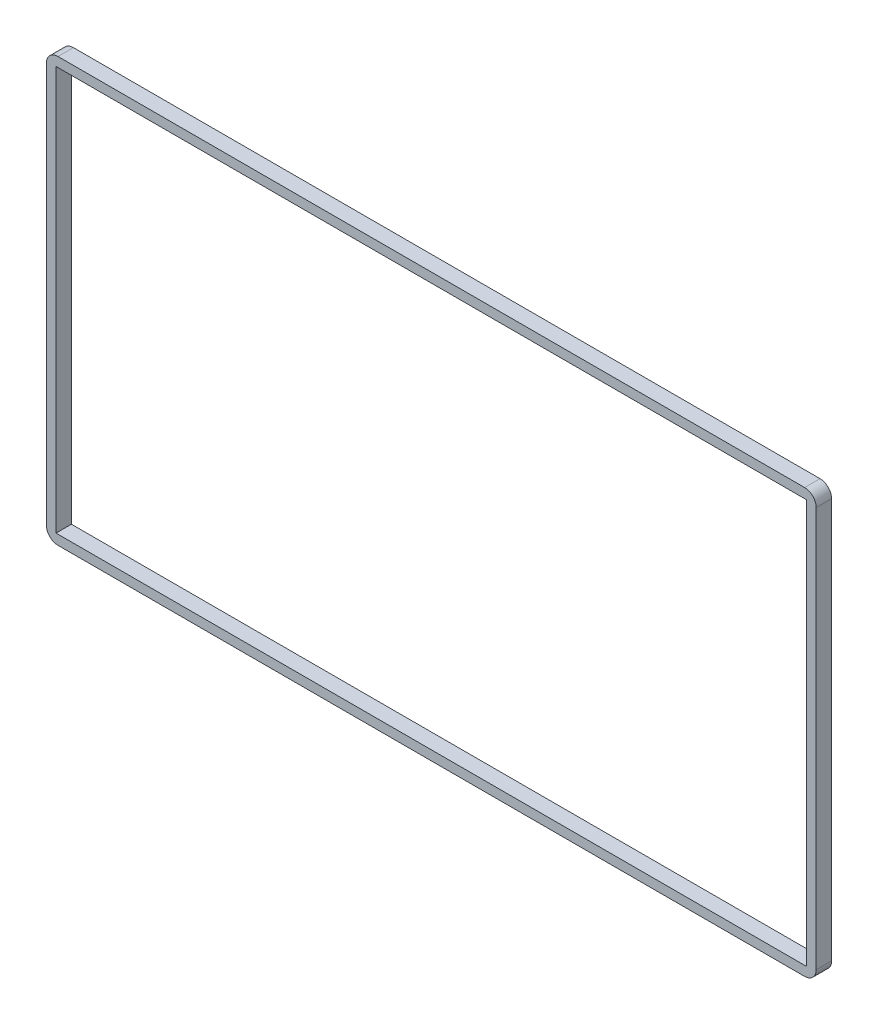
from build123d import *

# Parameters (mm, degrees)
SKETCH1_W           = 100
SKETCH1_H           = 55
SKETCH1_W_2         = 97.5
SKETCH1_H_2         = 52.5
BOSS_EXTRUDE1_DEPTH = 2
FILLET1_R           = 1.5


with BuildPart() as part:
    # Sketch1 → Boss-Extrude1 (new body)
    with BuildSketch(Plane.XY):
        with Locations((12.10302883, 11.151503687)):
            Rectangle(SKETCH1_W, SKETCH1_H)
        with Locations((12.10302883, 11.151503687)):
            Rectangle(SKETCH1_W_2, SKETCH1_H_2, mode=Mode.SUBTRACT)
    extrude(amount=BOSS_EXTRUDE1_DEPTH)

    # Fillet1
    fillet1_edges = [part.edges().sort_by_distance(p)[0] for p in [
        (-37.89697117, -16.348496313, 1),
        (62.10302883, -16.348496313, 1),
        (62.10302883, 38.651503687, 1),
        (-37.89697117, 38.651503687, 1),
    ]]
    fillet(fillet1_edges, radius=FILLET1_R)


solid = part.part
